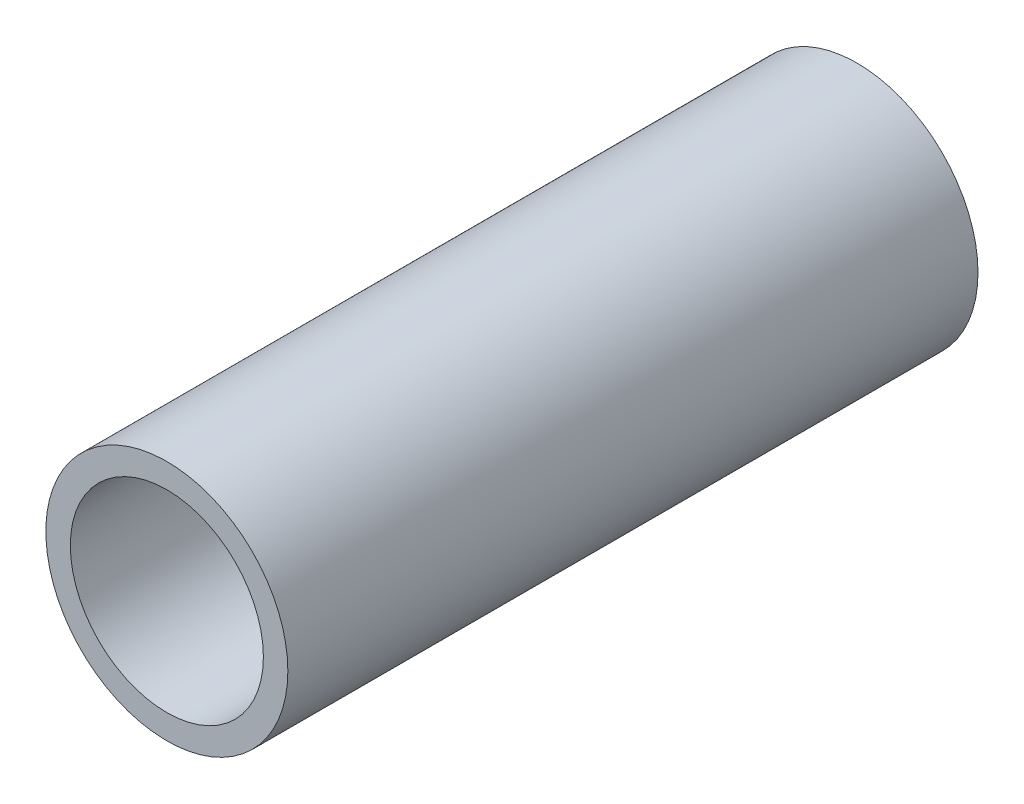
from build123d import *

# Parameters (mm, degrees)
SKETCH1_R           = 16.7005
SKETCH1_R_2         = 13.3223
EXTRUDE_THIN1_DEPTH = 47.625


with BuildPart() as part:
    # Sketch1 → Extrude-Thin1 (new, symmetric)
    with BuildSketch(Plane.XY):
        Circle(SKETCH1_R)
        Circle(SKETCH1_R_2, mode=Mode.SUBTRACT)
    extrude(amount=EXTRUDE_THIN1_DEPTH, both=True)


solid = part.part
